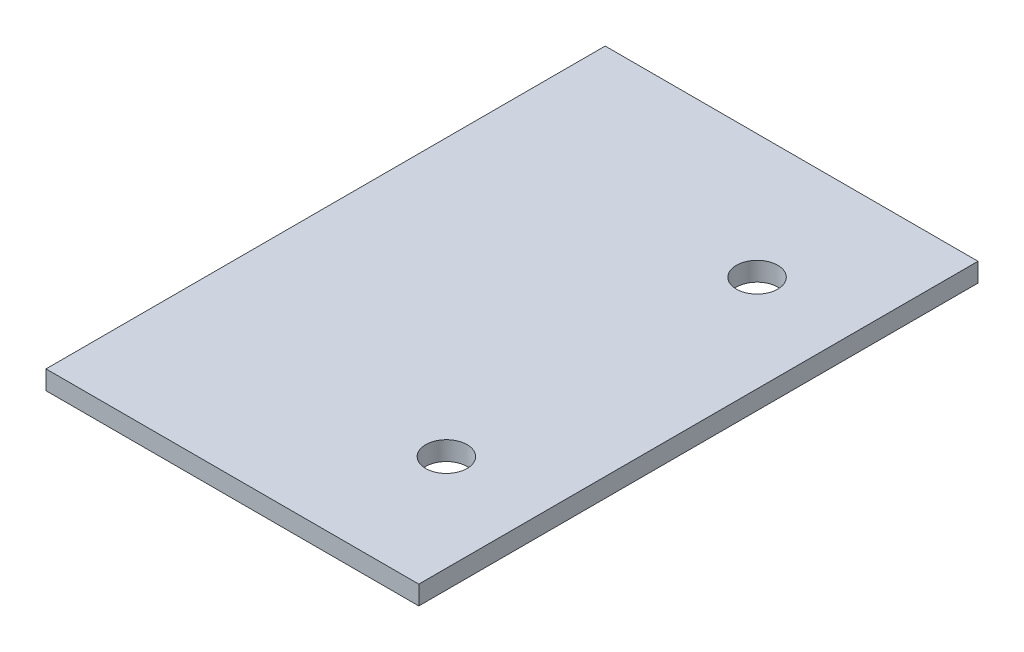
from build123d import *

# Parameters (mm, degrees)
SKETCH1_W           = 30
SKETCH1_H           = 45
BOSS_EXTRUDE1_DEPTH = 1.524
CUT_EXTRUDE1_REACH  = 29.085
SKETCH2_R           = 1.665


with BuildPart() as part:
    # Sketch1 → Boss-Extrude1 (new body)
    with BuildSketch(Plane(origin=(0, 0, 0), x_dir=(1, 0, 0), z_dir=(0, 1, 0))):
        Rectangle(SKETCH1_W, SKETCH1_H)
    extrude(amount=BOSS_EXTRUDE1_DEPTH)

    # Sketch2 → Cut-Extrude1 (cut, up to next)
    with BuildSketch(Plane(origin=(0, 1.524, 0), x_dir=(1, 0, 0), z_dir=(0, 1, 0)), mode=Mode.PRIVATE) as cut_extrude1_sk1:
        with Locations((7.221380866, 12.5)):
            Circle(SKETCH2_R)
    cut_extrude1_tool1 = extrude(cut_extrude1_sk1.sketch, amount=-CUT_EXTRUDE1_REACH, mode=Mode.PRIVATE) & part.part
    # Sketch2 → Cut-Extrude1 (cut, up to next)
    with BuildSketch(Plane(origin=(0, 1.524, 0), x_dir=(1, 0, 0), z_dir=(0, 1, 0)), mode=Mode.PRIVATE) as cut_extrude1_sk2:
        with Locations((7.221380866, -12.5)):
            Circle(SKETCH2_R)
    cut_extrude1_tool2 = extrude(cut_extrude1_sk2.sketch, amount=-CUT_EXTRUDE1_REACH, mode=Mode.PRIVATE) & part.part
    add(cut_extrude1_tool1.solids().sort_by_distance((7.221381, 1.524, -12.5))[0], mode=Mode.SUBTRACT)
    add(cut_extrude1_tool2.solids().sort_by_distance((7.221381, 1.524, 12.5))[0], mode=Mode.SUBTRACT)


solid = part.part
